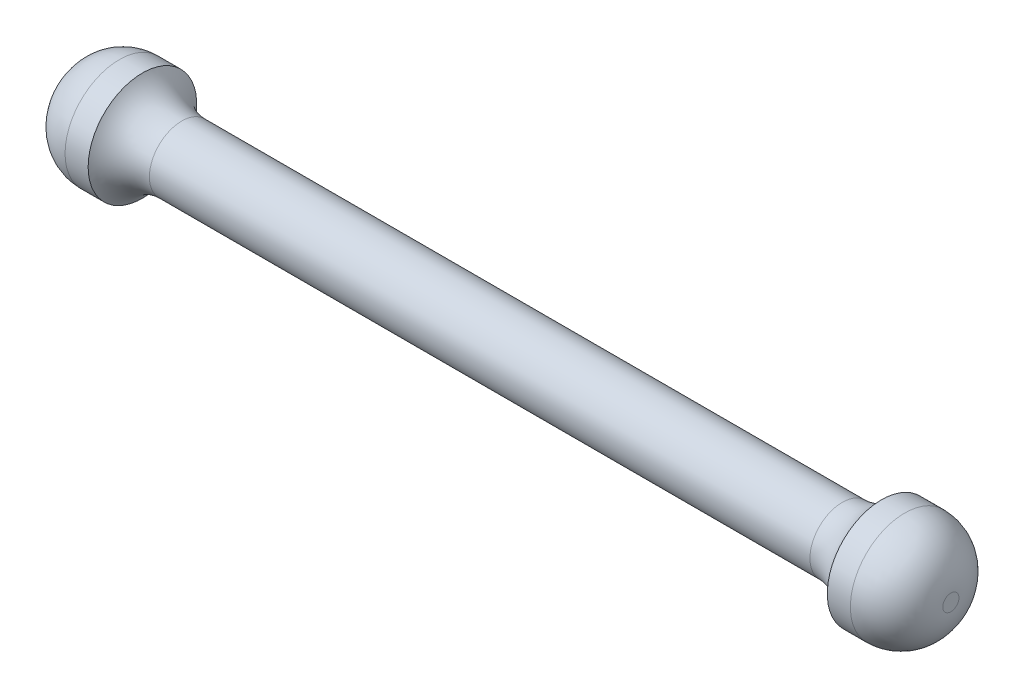
from build123d import *

# Parameters (mm, degrees)
BOSS_EXTRUDE1_START = 1
SKETCH1_R           = 1.4
BOSS_EXTRUDE1_DEPTH = 32
SKETCH2_R           = 2.35
BOSS_EXTRUDE2_DEPTH = 3
FILLET1_R           = 2
BOSS_EXTRUDE3_START = 3
SKETCH3_R           = 2.35
BOSS_EXTRUDE3_DEPTH = 3
FILLET2_R           = 2


with BuildPart() as part:
    # Sketch1 → Boss-Extrude1 (new body)
    with BuildSketch(Plane(origin=(15, 0, 0), x_dir=(0, 0, -1), z_dir=(1, 0, 0)).offset(BOSS_EXTRUDE1_START)):
        with Locations((32.233241632, 33)):
            Circle(SKETCH1_R)
    extrude(amount=-BOSS_EXTRUDE1_DEPTH)

    # Sketch2 → Boss-Extrude2 (add)
    with BuildSketch(Plane(origin=(16, 0, 0), x_dir=(0, 0, -1), z_dir=(1, 0, 0))):
        with Locations((32.233241632, 33)):
            Circle(SKETCH2_R)
    extrude(amount=BOSS_EXTRUDE2_DEPTH)

    # Fillet1
    # the kernel refuses this fillet: 2 mm, written as the material it adds along each edge
    with BuildSketch(Plane(origin=(16, 33, -32.233241632), x_dir=(0, 0, -1), z_dir=(0, -1, 0))) as fillet1_piece_1:
        with BuildLine():
            CenterArc((3.4, -1.702204453), FILLET1_R, 121.668243254, 58.331756746)
            Line((1.4, -1.702204453), (1.4, 0))
            Line((1.4, 0), (2.35, 0))
        make_face()
    revolve(axis=Axis((16, 33, -32.233241632), (1, 0, 0)))
    # the kernel refuses this fillet: 2 mm, written as the material it takes off along each edge
    with BuildSketch(Plane(origin=(19, 33, -32.233241632), x_dir=(0, 0, -1), z_dir=(0, -1, 0))) as fillet1_2_piece_1:
        with BuildLine():
            CenterArc((2.35 - FILLET1_R, -FILLET1_R), FILLET1_R, 0, 90)
            Line((2.35 - FILLET1_R, 0), (2.35, 0))
            Line((2.35, 0), (2.35, -FILLET1_R))
        make_face()
    revolve(axis=Axis((19, 33, -32.233241632), (1, 0, 0)), mode=Mode.SUBTRACT)

    # Sketch3 → Boss-Extrude3 (add)
    with BuildSketch(Plane.ZY.offset(16).offset(BOSS_EXTRUDE3_START)):
        with Locations(Location((-32.233241632, 33, 0), (0, 0, 180))):
            Circle(SKETCH3_R)
    extrude(amount=-BOSS_EXTRUDE3_DEPTH)

    # Fillet2
    # the kernel refuses this fillet: 2 mm, written as the material it adds along each edge
    with BuildSketch(Plane(origin=(-16, 33, -32.233241632), x_dir=(0, 0, -1), z_dir=(0, -1, 0))) as fillet2_piece_1:
        with BuildLine():
            CenterArc((3.4, 1.702204453), FILLET2_R, 180, 58.331756746)
            Line((1.4, 1.702204453), (1.4, 0))
            Line((1.4, 0), (2.35, 0))
        make_face()
    revolve(axis=Axis((-16, 33, -32.233241632), (1, 0, 0)))
    # the kernel refuses this fillet: 2 mm, written as the material it takes off along each edge
    with BuildSketch(Plane(origin=(-19, 33, -32.233241632), x_dir=(0, 0, -1), z_dir=(0, 1, 0))) as fillet2_2_piece_1:
        with BuildLine():
            CenterArc((2.35 - FILLET2_R, -FILLET2_R), FILLET2_R, 360, 90)
            Line((2.35 - FILLET2_R, 0), (2.35, 0))
            Line((2.35, 0), (2.35, -FILLET2_R))
        make_face()
    revolve(axis=Axis((-19, 33, -32.233241632), (-1, 0, 0)), mode=Mode.SUBTRACT)


solid = part.part
